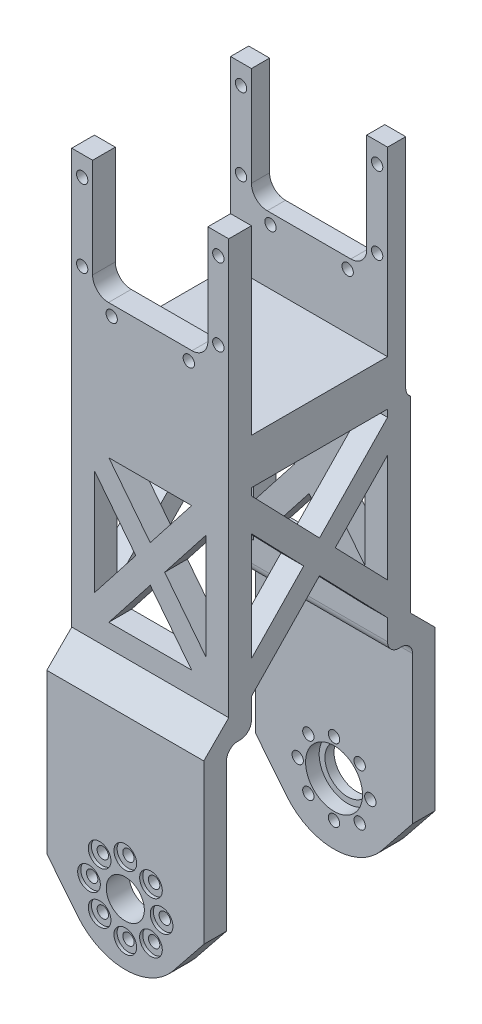
from build123d import *

# Parameters (mm, degrees)
SKETCH2_R                = 1.25
BOSS_EXTRUDE2_DEPTH      = 5
CUT_EXTRUDE1_START       = -7.5
CUT_EXTRUDE1_DEPTH       = 7.5
BOSS_EXTRUDE3_START      = -5
BOSS_EXTRUDE3_DEPTH      = 5
SKETCH5_W                = 34.60000004
SKETCH5_H                = 10
BOSS_EXTRUDE4_DEPTH      = 15
BOSS_EXTRUDE5_START      = 4
SKETCH6_R                = 1.25
SKETCH6_W                = 34.60000004
SKETCH6_H                = 10
BOSS_EXTRUDE5_DEPTH      = 4
SKETCH7_R                = 13.5
SKETCH7_R_2              = 1.25
SKETCH7_R_3              = 4.2
BOSS_EXTRUDE6_DEPTH      = 5
SKETCH7_5_R              = 13.5
SKETCH7_5_R_2            = 1.25
SKETCH7_5_R_3            = 4.2
BOSS_EXTRUDE7_DEPTH      = 5.5
BOSS_EXTRUDE8_DEPTH      = 5.5
CHAMFER1_SIZE            = 5.5
SKETCH10_R               = 1.25
SKETCH10_R_2             = 4.2
CUT_EXTRUDE3_DEPTH       = 5.5
FILLET1_R                = 2.5
CHAMFER2_SIZE            = 5.5
FILLET2_R                = 2.5
FILLET3_R                = 2.5
CUT_EXTRUDE4_REACH       = 131.961
BOSS_EXTRUDE9_DEPTH      = 5
SKETCH15_R               = 6.275
CUT_EXTRUDE5_DEPTH       = 3
SKETCH16_R               = 5
CUT_EXTRUDE6_DEPTH       = 132.227055137
SKETCH17_R               = 2.5
CUT_EXTRUDE7_DEPTH       = 0.7
CIRPATTERN1_COUNT        = 8
MIRROR11_COPY_1_SKETCH_R = 2.5
MIRROR11_COPY_1_DEPTH    = 0.7
MIRROR11_COPY_2_SKETCH_R = 2.5
MIRROR11_COPY_2_DEPTH    = 0.7
MIRROR11_COPY_3_SKETCH_R = 2.5
MIRROR11_COPY_3_DEPTH    = 0.7
MIRROR11_COPY_4_SKETCH_R = 2.5
MIRROR11_COPY_4_DEPTH    = 0.7
MIRROR11_COPY_5_SKETCH_R = 2.5
MIRROR11_COPY_5_DEPTH    = 0.7
MIRROR11_COPY_6_SKETCH_R = 2.5
MIRROR11_COPY_6_DEPTH    = 0.7
MIRROR11_COPY_7_SKETCH_R = 2.5
MIRROR11_COPY_7_DEPTH    = 0.7


# Some blends are built 0.0001 mm under size
with BuildPart() as part:
    # Sketch2 → Boss-Extrude2 (new body)
    with BuildSketch(Plane.XY):
        with BuildLine():
            Line((0, -5.099999997), (0, 0))
            Line((0, 0), (-9.200000019, 0))
            ThreePointArc((-9.200000019, 0), (-11.321320362, 0.878679656), (-12.200000019, 3))
            Line((-12.200000019, 3), (-12.200000019, 24.900000003))
            Line((-12.200000019, 24.900000003), (-17.30000002, 24.900000003))
            Line((-17.30000002, 24.900000003), (-17.30000002, 1.50273109))
            ThreePointArc((-17.30000002, 1.50273109), (-17.146499618, 0.640211738), (-16.704848314, -0.116389961))
            Line((-16.704848314, -0.116389961), (-13.217526888, -4.219121048))
            ThreePointArc((-13.217526888, -4.219121048), (-12.36201109, -4.869119058), (-11.312678594, -5.099999997))
            Line((-11.312678594, -5.099999997), (0, -5.099999997))
        make_face()
        with Locations((-14.999999994, 3.500000002)):
            Circle(SKETCH2_R, mode=Mode.SUBTRACT)
        with Locations((-8.499999994, -2.799999998)):
            Circle(SKETCH2_R, mode=Mode.SUBTRACT)
        with Locations((-14.999999994, 20.500000002)):
            Circle(SKETCH2_R, mode=Mode.SUBTRACT)
    boss_extrude2 = extrude(amount=BOSS_EXTRUDE2_DEPTH)

    # Mirror2: Boss-Extrude2 across plane
    add(boss_extrude2.mirror(Plane(origin=(0, 0, 5), x_dir=(0, 0, 1), z_dir=(1, 0, 0))))

    # Sketch3 → Cut-Extrude1 (cut)
    with BuildSketch(Plane.XY.offset(5).offset(CUT_EXTRUDE1_START)):
        with BuildLine():
            Line((-12.700000019, 24.900000003), (-12.700000019, 24.400000003))
            Line((-12.700000019, 24.400000003), (-12.700000019, 3))
            ThreePointArc((-12.700000019, 3), (-11.674873753, 0.525126266), (-9.200000019, -0.5))
            Line((-9.200000019, -0.5), (9.200000019, -0.5))
            ThreePointArc((9.200000019, -0.5), (11.674873753, 0.525126266), (12.700000019, 3))
            Line((12.700000019, 3), (12.700000019, 24.400000003))
            Line((12.700000019, 24.400000003), (12.700000019, 24.900000003))
            Line((12.700000019, 24.900000003), (12.200000019, 24.900000003))
            Line((12.200000019, 24.900000003), (12.200000019, 3))
            ThreePointArc((12.200000019, 3), (11.321320362, 0.878679656), (9.200000019, 0))
            Line((9.200000019, 0), (-9.200000019, 0))
            ThreePointArc((-9.200000019, 0), (-11.321320362, 0.878679656), (-12.200000019, 3))
            Line((-12.200000019, 3), (-12.200000019, 24.900000003))
            Line((-12.200000019, 24.900000003), (-12.700000019, 24.900000003))
        make_face()
    extrude(amount=CUT_EXTRUDE1_DEPTH, mode=Mode.SUBTRACT)

    # Sketch4 → Boss-Extrude3 (add)
    with BuildSketch(Plane.XY.offset(5).offset(BOSS_EXTRUDE3_START)):
        with BuildLine():
            Line((-17.30000002, -25.099999997), (17.30000002, -25.099999997))
            Line((17.30000002, -25.099999997), (17.30000002, 1.50273109))
            ThreePointArc((17.30000002, 1.50273109), (17.146499618, 0.640211738), (16.704848314, -0.116389961))
            Line((16.704848314, -0.116389961), (13.217526888, -4.219121048))
            ThreePointArc((13.217526888, -4.219121048), (12.36201109, -4.869119058), (11.312678594, -5.099999997))
            Line((11.312678594, -5.099999997), (-11.312678594, -5.099999997))
            ThreePointArc((-11.312678594, -5.099999997), (-12.36201109, -4.869119058), (-13.217526888, -4.219121048))
            Line((-13.217526888, -4.219121048), (-16.704848314, -0.116389961))
            ThreePointArc((-16.704848314, -0.116389961), (-17.146499618, 0.640211738), (-17.30000002, 1.50273109))
            Line((-17.30000002, 1.50273109), (-17.30000002, -25.099999997))
        make_face()
    extrude(amount=BOSS_EXTRUDE3_DEPTH)

    # Sketch5 → Boss-Extrude4 (add)
    with BuildSketch(Plane(origin=(0, 0, 0), x_dir=(-1, 0, 0), z_dir=(0, 0, -1))):
        with Locations((0, -20.099999997)):
            Rectangle(SKETCH5_W, SKETCH5_H)
    boss_extrude4 = extrude(amount=BOSS_EXTRUDE4_DEPTH)

    # Mirror4: Boss-Extrude4 across plane
    add(boss_extrude4.mirror(Plane(origin=(0, 0, -15), x_dir=(1, 0, 0), z_dir=(0, 0, -1))))

    # Sketch6 → Boss-Extrude5 (add)
    # profile 1 of 2: a face of its own
    with BuildSketch(Plane(origin=(0, 0, -30), x_dir=(-1, 0, 0), z_dir=(0, 0, -1)).offset(BOSS_EXTRUDE5_START)):
        with BuildLine():
            ThreePointArc((-12.700000019, 3), (-11.674873753, 0.525126266), (-9.200000019, -0.5))
            Line((-9.200000019, -0.5), (9.200000019, -0.5))
            ThreePointArc((9.200000019, -0.5), (11.674873753, 0.525126266), (12.700000019, 3))
            Line((12.700000019, 3), (12.700000019, 24.900000003))
            Line((12.700000019, 24.900000003), (17.30000002, 24.900000003))
            Line((17.30000002, 24.900000003), (17.30000002, -15.099999997))
            Line((17.30000002, -15.099999997), (-17.30000002, -15.099999997))
            Line((-17.30000002, -15.099999997), (-17.30000002, 24.900000003))
            Line((-17.30000002, 24.900000003), (-12.700000019, 24.900000003))
            Line((-12.700000019, 24.900000003), (-12.700000019, 3))
        make_face()
        with Locations((-14.999999994, 3.500000002)):
            Circle(SKETCH6_R, mode=Mode.SUBTRACT)
        with Locations((-14.999999994, 20.500000002)):
            Circle(SKETCH6_R, mode=Mode.SUBTRACT)
        with Locations((-8.499999994, -2.799999998)):
            Circle(SKETCH6_R, mode=Mode.SUBTRACT)
        with Locations(Location((14.999999994, 3.500000002, 0), (0, 0, 180))):
            Circle(SKETCH6_R, mode=Mode.SUBTRACT)
        with Locations(Location((14.999999994, 20.500000002, 0), (0, 0, 180))):
            Circle(SKETCH6_R, mode=Mode.SUBTRACT)
        with Locations(Location((8.499999994, -2.799999998, 0), (0, 0, 180))):
            Circle(SKETCH6_R, mode=Mode.SUBTRACT)
    # profile 2 of 2: a face of its own
    with BuildSketch(Plane(origin=(0, 0, -30), x_dir=(-1, 0, 0), z_dir=(0, 0, -1)).offset(BOSS_EXTRUDE5_START)):
        with Locations((0, -20.099999997)):
            Rectangle(SKETCH6_W, SKETCH6_H)
    extrude(amount=-BOSS_EXTRUDE5_DEPTH)

    # Sketch7 → Boss-Extrude6 (add)
    # profile 1 of 2: a face of its own
    with BuildSketch(Plane.XY.offset(5)):
        with BuildLine():
            Line((17.30000002, -25.099999997), (-17.30000002, -25.099999997))
            Line((-17.30000002, -25.099999997), (-17.30000002, -106.999999997))
            Line((-17.30000002, -106.999999997), (-10.534682069, -115.442184175))
            ThreePointArc((-10.534682069, -115.442184175), (-4.473912833, -94.262884783), (13.5, -106.999999997))
            ThreePointArc((13.5, -106.999999997), (12.737115214, -111.473912829), (10.534682069, -115.442184175))
            Line((10.534682069, -115.442184175), (17.30000002, -106.999999997))
            Line((17.30000002, -106.999999997), (17.30000002, -25.099999997))
        make_face()
    # profile 2 of 2: a face of its own
    with BuildSketch(Plane.XY.offset(5)):
        with Locations((0, -106.999999997)):
            Circle(SKETCH7_R)
        with Locations((8, -106.999999997)):
            Circle(SKETCH7_R_2, mode=Mode.SUBTRACT)
        with Locations((0, -114.999999997)):
            Circle(SKETCH7_R_2, mode=Mode.SUBTRACT)
        with Locations((-8, -106.999999997)):
            Circle(SKETCH7_R_2, mode=Mode.SUBTRACT)
        with Locations((5.656854249, -112.656854246)):
            Circle(SKETCH7_R_2, mode=Mode.SUBTRACT)
        with Locations((-5.656854249, -112.656854246)):
            Circle(SKETCH7_R_2, mode=Mode.SUBTRACT)
        with Locations((5.656854249, -101.343145747)):
            Circle(SKETCH7_R_2, mode=Mode.SUBTRACT)
        with Locations((-5.656854249, -101.343145747)):
            Circle(SKETCH7_R_2, mode=Mode.SUBTRACT)
        with Locations((0, -98.999999997)):
            Circle(SKETCH7_R_2, mode=Mode.SUBTRACT)
        with Locations((0, -106.999999997)):
            Circle(SKETCH7_R_3, mode=Mode.SUBTRACT)
    boss_extrude6 = extrude(amount=-BOSS_EXTRUDE6_DEPTH)

    # Mirror7: Boss-Extrude6 across plane
    add(boss_extrude6.mirror(Plane(origin=(0, 0, -15), x_dir=(1, 0, 0), z_dir=(0, 0, -1))))

    # Sketch7<5> → Boss-Extrude7 (add)
    with BuildSketch(Plane.XY.offset(5)):
        with Locations((0, -106.999999997)):
            Circle(SKETCH7_5_R)
        with Locations((8, -106.999999997)):
            Circle(SKETCH7_5_R_2, mode=Mode.SUBTRACT)
        with Locations((0, -114.999999997)):
            Circle(SKETCH7_5_R_2, mode=Mode.SUBTRACT)
        with Locations((-8, -106.999999997)):
            Circle(SKETCH7_5_R_2, mode=Mode.SUBTRACT)
        with Locations((5.656854249, -112.656854246)):
            Circle(SKETCH7_5_R_2, mode=Mode.SUBTRACT)
        with Locations((-5.656854249, -112.656854246)):
            Circle(SKETCH7_5_R_2, mode=Mode.SUBTRACT)
        with Locations((5.656854249, -101.343145747)):
            Circle(SKETCH7_5_R_2, mode=Mode.SUBTRACT)
        with Locations((-5.656854249, -101.343145747)):
            Circle(SKETCH7_5_R_2, mode=Mode.SUBTRACT)
        with Locations((0, -98.999999997)):
            Circle(SKETCH7_5_R_2, mode=Mode.SUBTRACT)
        with Locations((0, -106.999999997)):
            Circle(SKETCH7_5_R_3, mode=Mode.SUBTRACT)
    boss_extrude7 = extrude(amount=BOSS_EXTRUDE7_DEPTH)

    # Sketch9 → Boss-Extrude8 (add)
    with BuildSketch(Plane.XY.offset(5)):
        with BuildLine():
            Line((17.30000002, -71.999999997), (-17.30000002, -71.999999997))
            Line((-17.30000002, -71.999999997), (-17.30000002, -106.999999997))
            Line((-17.30000002, -106.999999997), (-10.534682069, -115.442184175))
            ThreePointArc((-10.534682069, -115.442184175), (0, -93.499999997), (10.534682069, -115.442184175))
            Line((10.534682069, -115.442184175), (17.30000002, -106.999999997))
            Line((17.30000002, -106.999999997), (17.30000002, -71.999999997))
        make_face()
    boss_extrude8 = extrude(amount=BOSS_EXTRUDE8_DEPTH)

    # Chamfer1
    chamfer1_edges = [part.edges().sort_by_distance(p)[0] for p in [
        (0, -71.999999997, 5),
    ]]
    chamfer(chamfer1_edges, length=CHAMFER1_SIZE - 0.0001)  # a hair under: the kernel refuses the full size

    # Sketch10 → Cut-Extrude3 (cut)
    with BuildSketch(Plane(origin=(0, 0, 0), x_dir=(-1, 0, 0), z_dir=(0, 0, -1))):
        with BuildLine():
            Line((17.30000002, -71.999999997), (-17.30000002, -71.999999997))
            Line((-17.30000002, -71.999999997), (-17.30000002, -106.999999997))
            Line((-17.30000002, -106.999999997), (-10.534682069, -115.442184175))
            ThreePointArc((-10.534682069, -115.442184175), (0, -120.499999997), (10.534682069, -115.442184175))
            Line((10.534682069, -115.442184175), (17.30000002, -106.999999997))
            Line((17.30000002, -106.999999997), (17.30000002, -71.999999997))
        make_face()
        with Locations(Location((-5.656854249, -112.656854246, 0), (0, 0, 180))):
            Circle(SKETCH10_R, mode=Mode.SUBTRACT)
        with Locations(Location((-8, -106.999999997, 0), (0, 0, 180))):
            Circle(SKETCH10_R, mode=Mode.SUBTRACT)
        with Locations(Location((-5.656854249, -101.343145747, 0), (0, 0, 180))):
            Circle(SKETCH10_R, mode=Mode.SUBTRACT)
        with Locations(Location((0, -114.999999997, 0), (0, 0, 180))):
            Circle(SKETCH10_R, mode=Mode.SUBTRACT)
        with Locations(Location((5.656854249, -112.656854246, 0), (0, 0, 180))):
            Circle(SKETCH10_R, mode=Mode.SUBTRACT)
        with Locations(Location((0, -106.999999997, 0), (0, 0, 180))):
            Circle(SKETCH10_R_2, mode=Mode.SUBTRACT)
        with Locations(Location((0, -98.999999997, 0), (0, 0, 180))):
            Circle(SKETCH10_R, mode=Mode.SUBTRACT)
        with Locations(Location((8, -106.999999997, 0), (0, 0, 180))):
            Circle(SKETCH10_R, mode=Mode.SUBTRACT)
        with Locations(Location((5.656854249, -101.343145747, 0), (0, 0, 180))):
            Circle(SKETCH10_R, mode=Mode.SUBTRACT)
    cut_extrude3 = extrude(amount=-CUT_EXTRUDE3_DEPTH, mode=Mode.SUBTRACT)

    # Fillet1
    fillet1_edges = [part.edges().sort_by_distance(p)[0] for p in [
        (0, -71.999999997, 0),
        (0, -71.999999997, 5.5),
    ]]
    fillet(fillet1_edges, radius=FILLET1_R)

    # Mirror8: Boss-Extrude7, Boss-Extrude8 across plane
    add(boss_extrude7.mirror(Plane(origin=(0, 0, -15), x_dir=(1, 0, 0), z_dir=(0, 0, -1))))
    add(boss_extrude8.mirror(Plane(origin=(0, 0, -15), x_dir=(1, 0, 0), z_dir=(0, 0, -1))))

    # Chamfer2
    chamfer2_edges = [part.edges().sort_by_distance(p)[0] for p in [
        (0, -71.999999997, -35),
    ]]
    chamfer(chamfer2_edges, length=CHAMFER2_SIZE - 0.0001)  # a hair under: the kernel refuses the full size

    # Fillet2
    # the kernel refuses this fillet: 2.5 mm, written as the material it adds along each edge
    with BuildSketch(Plane(origin=(17.30000002, -25.099999997, -34), x_dir=(0, 0, -1), z_dir=(-1, 0, 0))) as fillet2_piece_1:
        with BuildLine():
            CenterArc((2.5, -2), FILLET2_R, 126.869897646, 53.130102354)
            Line((0, -2), (-0.05, -2))
            Line((-0.05, -2), (-0.05, 0))
            Line((-0.05, 0), (0, 0.05))
            ThreePointArc((0, 0.05), (0.5, 0.05), (0.97, 0.04))
            Line((0.97, 0.04), (1, 0))
        make_face()
    extrude(amount=34.600000039)

    # Mirror9: Cut-Extrude3 across plane
    add(cut_extrude3.mirror(Plane(origin=(0, 0, -15), x_dir=(1, 0, 0), z_dir=(0, 0, -1))), mode=Mode.SUBTRACT)

    # Fillet3
    fillet3_edges = [part.edges().sort_by_distance(p)[0] for p in [
        (0, -71.999999997, -35.5),
        (0, -71.999999997, -30),
    ]]
    fillet(fillet3_edges, radius=FILLET3_R)

    # Sketch11 → Cut-Extrude4 (cut, up to next)
    with BuildSketch(Plane.XY.offset(5), mode=Mode.PRIVATE) as cut_extrude4_sk1:
        Polygon((-12.30000002, -34.15374446), (-12.30000002, -57.446255533), (-3.175863502, -45.799999997), align=None)
    cut_extrude4_tool1 = extrude(cut_extrude4_sk1.sketch, amount=-CUT_EXTRUDE4_REACH, mode=Mode.PRIVATE) & part.part
    # Sketch11 → Cut-Extrude4 (cut, up to next)
    with BuildSketch(Plane.XY.offset(5), mode=Mode.PRIVATE) as cut_extrude4_sk2:
        Polygon((0, -49.85374446), (-9.124136518, -61.499999997), (9.124136518, -61.499999997), align=None)
    cut_extrude4_tool2 = extrude(cut_extrude4_sk2.sketch, amount=-CUT_EXTRUDE4_REACH, mode=Mode.PRIVATE) & part.part
    # Sketch11 → Cut-Extrude4 (cut, up to next)
    with BuildSketch(Plane.XY.offset(5), mode=Mode.PRIVATE) as cut_extrude4_sk3:
        Polygon((9.124136518, -30.099999997), (-9.124136518, -30.099999997), (0, -41.746255533), align=None)
    cut_extrude4_tool3 = extrude(cut_extrude4_sk3.sketch, amount=-CUT_EXTRUDE4_REACH, mode=Mode.PRIVATE) & part.part
    # Sketch11 → Cut-Extrude4 (cut, up to next)
    with BuildSketch(Plane.XY.offset(5), mode=Mode.PRIVATE) as cut_extrude4_sk4:
        Polygon((3.175863502, -45.799999997), (12.30000002, -57.446255533), (12.30000002, -34.15374446), align=None)
    cut_extrude4_tool4 = extrude(cut_extrude4_sk4.sketch, amount=-CUT_EXTRUDE4_REACH, mode=Mode.PRIVATE) & part.part
    add(cut_extrude4_tool1.solids().sort_by_distance((-9.258621, -45.8, 5))[0], mode=Mode.SUBTRACT)
    add(cut_extrude4_tool1.solids().sort_by_distance((-9.258621, -45.8, 5))[1], mode=Mode.SUBTRACT)
    add(cut_extrude4_tool2.solids().sort_by_distance((0, -57.617915, 5))[0], mode=Mode.SUBTRACT)
    add(cut_extrude4_tool2.solids().sort_by_distance((0, -57.617915, 5))[1], mode=Mode.SUBTRACT)
    add(cut_extrude4_tool3.solids().sort_by_distance((0, -33.982085, 5))[0], mode=Mode.SUBTRACT)
    add(cut_extrude4_tool3.solids().sort_by_distance((0, -33.982085, 5))[1], mode=Mode.SUBTRACT)
    add(cut_extrude4_tool4.solids().sort_by_distance((9.258621, -45.8, 5))[0], mode=Mode.SUBTRACT)
    add(cut_extrude4_tool4.solids().sort_by_distance((9.258621, -45.8, 5))[1], mode=Mode.SUBTRACT)

    # Sketch12 → Boss-Extrude9 (add)
    with BuildSketch(Plane.ZY.offset(17.30000002)):
        Polygon((-30, -57.727062219), (-30, -61.324999997), (-16.738134192, -47.598968885), (-18.476268384, -45.799999997), align=None)
        Polygon((-16.738134192, -47.598968885), (-30, -61.324999997), (-30, -64.922937774), (-15, -49.397937774), align=None)
        Polygon((-30, -30.274999997), (-30, -33.872937774), (-18.476268384, -45.799999997), (-16.738134192, -44.001031108), align=None)
        Polygon((-30, -26.677062219), (-30, -30.274999997), (-16.738134192, -44.001031108), (-15, -42.202062219), align=None)
        Polygon((-18.476268384, -45.799999997), (-16.738134192, -47.598968885), (-15, -45.799999997), (-16.738134192, -44.001031108), align=None)
        Polygon((-15, -45.799999997), (-16.738134192, -47.598968885), (-15, -49.397937774), (-13.261865808, -47.598968885), align=None)
        Polygon((-13.261865808, -44.001031108), (-15, -45.799999997), (-13.261865808, -47.598968885), (-11.523731616, -45.799999997), align=None)
        Polygon((-16.738134192, -44.001031108), (-15, -45.799999997), (-13.261865808, -44.001031108), (-15, -42.202062219), align=None)
        Polygon((-15, -42.202062219), (-13.261865808, -44.001031108), (0, -30.274999997), (0, -26.677062219), align=None)
        Polygon((0, -30.274999997), (-13.261865808, -44.001031108), (-11.523731616, -45.799999997), (0, -33.872937774), align=None)
        Polygon((-11.523731616, -45.799999997), (-13.261865808, -47.598968885), (0, -61.324999997), (0, -57.727062219), align=None)
        Polygon((-13.261865808, -47.598968885), (-15, -49.397937774), (0, -64.922937774), (0, -61.324999997), align=None)
    boss_extrude9 = extrude(amount=-BOSS_EXTRUDE9_DEPTH)

    # Mirror10: Boss-Extrude9 across plane
    add(boss_extrude9.mirror(Plane(origin=(0, 0, 0), x_dir=(0, 0, 1), z_dir=(1, 0, 0))))

    # Sketch15 → Cut-Extrude5 (cut)
    with BuildSketch(Plane.XY.offset(-35.5)):
        with Locations((0, -106.999999997)):
            Circle(SKETCH15_R)
    extrude(amount=-CUT_EXTRUDE5_DEPTH, mode=Mode.SUBTRACT)

    # Sketch16 → Cut-Extrude6 (cut, through all)
    with BuildSketch(Plane.XY.offset(-38.5)):
        with Locations((0, -106.999999997)):
            Circle(SKETCH16_R)
    extrude(amount=-CUT_EXTRUDE6_DEPTH, mode=Mode.SUBTRACT)

    # Sketch17 → Cut-Extrude7 (cut)
    with BuildSketch(Plane.XY.offset(10.5)):
        with Locations((0, -98.999999997)):
            Circle(SKETCH17_R)
    cut_extrude7 = extrude(amount=-CUT_EXTRUDE7_DEPTH, mode=Mode.SUBTRACT)

    # CirPattern1: Cut-Extrude7 ×8 about axis
    cirpattern1_axis = Axis((0, -106.999999997, 0), (0, 0, 1))
    for i in range(1, CIRPATTERN1_COUNT):
        add(cut_extrude7.rotate(cirpattern1_axis, i * 360 / CIRPATTERN1_COUNT), mode=Mode.SUBTRACT)

    # Mirror11: Cut-Extrude7 across plane
    add(cut_extrude7.mirror(Plane.XY.offset(-15)), mode=Mode.SUBTRACT)

    # Mirror11 copy 1 sketch → Mirror11 copy 1 (cut)
    with BuildSketch(Plane(origin=(-75.660425585, -31.339574412, -40.5), x_dir=(0.7071067811865476, 0.7071067811865475, 0), z_dir=(0, 0, -1))):
        with Locations((0, 98.999999997)):
            Circle(MIRROR11_COPY_1_SKETCH_R)
    extrude(amount=-MIRROR11_COPY_1_DEPTH, mode=Mode.SUBTRACT)

    # Mirror11 copy 2 sketch → Mirror11 copy 2 (cut)
    with BuildSketch(Plane(origin=(-106.999999997, -106.999999997, -40.5), x_dir=(0, 1, 0), z_dir=(0, 0, -1))):
        with Locations((0, 98.999999997)):
            Circle(MIRROR11_COPY_2_SKETCH_R)
    extrude(amount=-MIRROR11_COPY_2_DEPTH, mode=Mode.SUBTRACT)

    # Mirror11 copy 3 sketch → Mirror11 copy 3 (cut)
    with BuildSketch(Plane(origin=(-75.660425585, -182.660425581, -40.5), x_dir=(-0.7071067811865475, 0.7071067811865476, 0), z_dir=(0, 0, -1))):
        with Locations((0, 98.999999997)):
            Circle(MIRROR11_COPY_3_SKETCH_R)
    extrude(amount=-MIRROR11_COPY_3_DEPTH, mode=Mode.SUBTRACT)

    # Mirror11 copy 4 sketch → Mirror11 copy 4 (cut)
    with BuildSketch(Plane(origin=(0, -213.999999993, -40.5), x_dir=(-1, 0, 0), z_dir=(0, 0, -1))):
        with Locations((0, 98.999999997)):
            Circle(MIRROR11_COPY_4_SKETCH_R)
    extrude(amount=-MIRROR11_COPY_4_DEPTH, mode=Mode.SUBTRACT)

    # Mirror11 copy 5 sketch → Mirror11 copy 5 (cut)
    with BuildSketch(Plane(origin=(75.660425585, -182.660425581, -40.5), x_dir=(-0.7071067811865477, -0.7071067811865475, 0), z_dir=(0, 0, -1))):
        with Locations((0, 98.999999997)):
            Circle(MIRROR11_COPY_5_SKETCH_R)
    extrude(amount=-MIRROR11_COPY_5_DEPTH, mode=Mode.SUBTRACT)

    # Mirror11 copy 6 sketch → Mirror11 copy 6 (cut)
    with BuildSketch(Plane(origin=(106.999999997, -106.999999997, -40.5), x_dir=(0, -1, 0), z_dir=(0, 0, -1))):
        with Locations((0, 98.999999997)):
            Circle(MIRROR11_COPY_6_SKETCH_R)
    extrude(amount=-MIRROR11_COPY_6_DEPTH, mode=Mode.SUBTRACT)

    # Mirror11 copy 7 sketch → Mirror11 copy 7 (cut)
    with BuildSketch(Plane(origin=(75.660425585, -31.339574412, -40.5), x_dir=(0.7071067811865474, -0.7071067811865477, 0), z_dir=(0, 0, -1))):
        with Locations((0, 98.999999997)):
            Circle(MIRROR11_COPY_7_SKETCH_R)
    extrude(amount=-MIRROR11_COPY_7_DEPTH, mode=Mode.SUBTRACT)


solid = part.part
